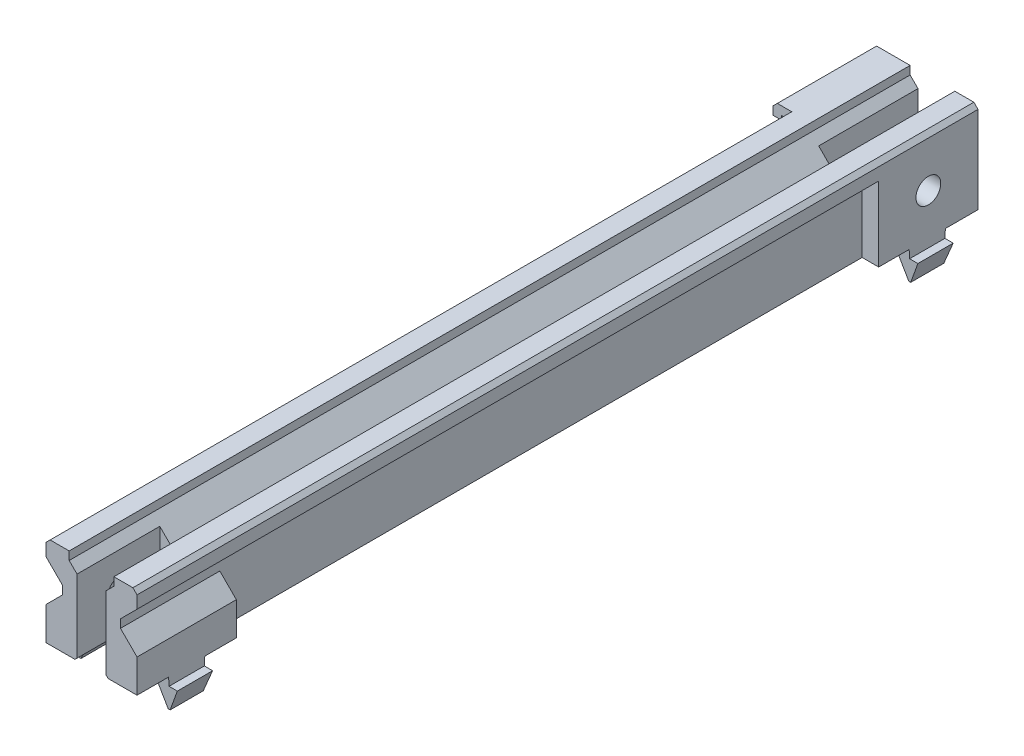
from build123d import *

# Parameters (mm, degrees)
SKETCH1_W                        = 5.5
SKETCH1_H                        = 11
MAIN_BASE_DEPTH                  = 101.61
SIDE_CUT_OUT_DEPTH               = 89.61
TOP_RUBBER_BAND_CUT_OUT_DEPTH    = 103.351561297
BOTTOM_RUBBER_BAND_CUT_OUT_DEPTH = 103.351561297
SKETCH6_W                        = 1.75
SKETCH6_H                        = 11
MOTOR_PULLEY_CUT_OUT_DEPTH       = 12
SKETCH7_W                        = 1.75
SKETCH7_H                        = 11
PULLEY_CUT_OUT_DEPTH             = 10
SKETCH11_R                       = 1.5
MOTOR_SHAFT_CUT_OUT_DEPTH        = 103.272452792
SNAP_START                       = 5.27
SNAP_HOOK_DRIVEN_SIDE_DEPTH      = 0.23
SNAP_START_2                     = -97.613689555
SNAP_HOOK_DRIVEN_SIDE_2_DEPTH    = 4.266231519
SNAP_START_3                     = -97.666097334
SNAP_HOOK_DRIVEN_SIDE_3_DEPTH    = 4.371047077
SNAP_START_4                     = 3
SNAP_HOOK_DRIVEN_SIDE_4_DEPTH    = 4
SKETCH16_W                       = 2
SKETCH16_H                       = 6
SNAP_HOOK_BASE_DEPTH             = 12
SNAP_HOOK_BASE_CHAMFER_SIZE      = 2
SNAP_HOOK_GUIDE_SIDE_DEPTH       = 0.23
SNAP_START_5                     = -8.132595504
SNAP_HOOK_GUIDE_SIDE_2_DEPTH     = 4.266231519
SNAP_START_6                     = -8.185003283
SNAP_HOOK_GUIDE_SIDE_3_DEPTH     = 4.371047078
SNAP_HOOK_GUIDE_SIDE_4_DEPTH     = 4
SKETCH13_W                       = 1
SKETCH13_H                       = 0.5
BOSS_EXTRUDE3_DEPTH              = 12
RAIL_CHAMFER_SIZE                = 0.5


with BuildPart() as part:
    # Sketch1 → main_base (new body)
    with BuildSketch(Plane.XY):
        with Locations((2.75, 5.5)):
            Rectangle(SKETCH1_W, SKETCH1_H)
    extrude(amount=-MAIN_BASE_DEPTH)

    # Sketch3 → side_cut_out (cut)
    with BuildSketch(Plane.XY):
        Polygon((5.5, 9), (3.5, 7), (3.5, 0), (5.5, 0), align=None)
    extrude(amount=-SIDE_CUT_OUT_DEPTH, mode=Mode.SUBTRACT)

    # Sketch4 → top_rubber_band_cut_out (cut, through all)
    with BuildSketch(Plane.XY):
        Polygon((0, 7.3), (0, 11), (2.7, 11), (2.7, 10), align=None)
    extrude(amount=-TOP_RUBBER_BAND_CUT_OUT_DEPTH, mode=Mode.SUBTRACT)

    # Sketch5 → bottom_rubber_band_cut_out (cut, through all)
    with BuildSketch(Plane.XY):
        Polygon((2, 0), (0, 2), (0, 0), align=None)
    extrude(amount=-BOTTOM_RUBBER_BAND_CUT_OUT_DEPTH, mode=Mode.SUBTRACT)

    # Sketch6 → motor_pulley_cut_out (cut)
    with BuildSketch(Plane(origin=(0, 0, -101.61), x_dir=(-1, 0, 0), z_dir=(0, 0, -1))):
        with Locations((-0.875, 5.5)):
            Rectangle(SKETCH6_W, SKETCH6_H)
    extrude(amount=-MOTOR_PULLEY_CUT_OUT_DEPTH, mode=Mode.SUBTRACT)

    # Sketch7 → pulley_cut_out (cut)
    with BuildSketch(Plane.XY):
        with Locations((0.875, 5.5)):
            Rectangle(SKETCH7_W, SKETCH7_H)
    extrude(amount=-PULLEY_CUT_OUT_DEPTH, mode=Mode.SUBTRACT)

    # Sketch10 → half_circle_cut_out (revolve, cut)
    with BuildSketch(Plane(origin=(0, 5, 0), x_dir=(1, 0, 0), z_dir=(0, 1, 0))):
        with BuildLine():
            Line((1.5, 5), (1.5, 3.75))
            ThreePointArc((1.5, 3.75), (2.383883476, 4.116116524), (2.75, 5))
            Line((2.75, 5), (1.5, 5))
        make_face()
    revolve(axis=Axis((2.75, 5, -5), (-1, 0, 0)), mode=Mode.SUBTRACT)

    # Sketch11 → motor_shaft_cut_out (cut, through all)
    with BuildSketch(Plane.ZY.offset(-1.75)):
        with Locations((-95.61, 5)):
            Circle(SKETCH11_R)
    extrude(amount=-MOTOR_SHAFT_CUT_OUT_DEPTH, mode=Mode.SUBTRACT)



with BuildPart() as body_2:
    # Snap Hook Driven Side: read off the stored shape, not the designer's step
    # Snap Hook Driven Side outline → Snap Hook Driven Side (new body)
    with BuildSketch(Plane.YZ.offset(SNAP_START)):
        Polygon((-1, -97.613689555), (-1, -93.347458036), (-3.54, -93.480573796), (-3.54, -97.480573796), align=None)
    extrude(amount=SNAP_HOOK_DRIVEN_SIDE_DEPTH)


with BuildPart() as part_1:
    add(part.part)

    add(body_2.part)  # Snap Hook Driven Side 2 merges body 2
    # Snap Hook Driven Side 2 outline → Snap Hook Driven Side 2 (add)
    with BuildSketch(Plane.XY.offset(SNAP_START_2)):
        Polygon((5.5, 0), (3.5, 0), (5.27, -3.54), (5.27, -1), (5.5, -1), align=None)
        Polygon((6.5, -1), (5.5, -1), (5.5, -3.54), align=None)
    extrude(amount=SNAP_HOOK_DRIVEN_SIDE_2_DEPTH)

    # Snap Hook Driven Side 3 outline → Snap Hook Driven Side 3 (add)
    with BuildSketch(Plane.XY.offset(SNAP_START_3)):
        Polygon((5.5, 0), (3.5, 0), (5.27, -3.54), (5.27, -1), (5.5, -1), align=None)
    extrude(amount=SNAP_HOOK_DRIVEN_SIDE_3_DEPTH)

    # Snap Hook Driven Side 4 outline → Snap Hook Driven Side 4 (cut)
    with BuildSketch(Plane.YZ.offset(SNAP_START_4)):
        Polygon((0, -93.295050257), (-5, -93.295050257), (-5, -93.557089154), (-3.54, -93.480573796), align=None)
        Polygon((-3.54, -97.480573796), (-5, -97.404058439), (-5, -97.666097334), (0, -97.666097334), align=None)
    extrude(amount=SNAP_HOOK_DRIVEN_SIDE_4_DEPTH, mode=Mode.SUBTRACT)

    # Sketch16 → Snap Hook Base (add)
    with BuildSketch(Plane.XY):
        with Locations((4.5, 3)):
            Rectangle(SKETCH16_W, SKETCH16_H)
    extrude(amount=-SNAP_HOOK_BASE_DEPTH)

    # Snap Hook Base Chamfer
    snap_hook_base_chamfer_edges = [part_1.edges().sort_by_distance(p)[0] for p in [
        (5.5, 6, -6),
    ]]
    chamfer(snap_hook_base_chamfer_edges, length=SNAP_HOOK_BASE_CHAMFER_SIZE - 0.0001)  # a hair under: the kernel refuses the full size



with BuildPart() as body_2_2:
    # Snap Hook Guide Side: read off the stored shape, not the designer's step
    # Snap Hook Guide Side outline → Snap Hook Guide Side (new body)
    with BuildSketch(Plane.YZ.offset(SNAP_START)):
        Polygon((-1, -3.866363984), (-3.54, -3.999479744), (-3.54, -7.999479744), (-1, -8.132595504), align=None)
    extrude(amount=SNAP_HOOK_GUIDE_SIDE_DEPTH)


with BuildPart() as part_2:
    add(part_1.part)

    add(body_2_2.part)  # Snap Hook Guide Side 2 merges body 2 2
    # Snap Hook Guide Side 2 outline → Snap Hook Guide Side 2 (add)
    with BuildSketch(Plane.XY.offset(SNAP_START_5)):
        Polygon((5.27, -1), (5.5, -1), (5.5, 0), (3.5, 0), (5.27, -3.54), align=None)
        Polygon((6.5, -1), (5.5, -1), (5.5, -3.54), align=None)
    extrude(amount=SNAP_HOOK_GUIDE_SIDE_2_DEPTH)

    # Snap Hook Guide Side 3 outline → Snap Hook Guide Side 3 (add)
    with BuildSketch(Plane.XY.offset(SNAP_START_6)):
        Polygon((5.27, -1), (5.5, -1), (5.5, 0), (3.5, 0), (5.27, -3.54), align=None)
    extrude(amount=SNAP_HOOK_GUIDE_SIDE_3_DEPTH)

    # Snap Hook Guide Side 4 outline → Snap Hook Guide Side 4 (cut)
    with BuildSketch(Plane.YZ.offset(SNAP_START_4)):
        Polygon((0, -3.813956205), (-5, -3.813956205), (-5, -4.075995102), (-3.54, -3.999479744), align=None)
        Polygon((-3.54, -7.999479744), (-5, -7.922964386), (-5, -8.185003283), (0, -8.185003283), align=None)
    extrude(amount=SNAP_HOOK_GUIDE_SIDE_4_DEPTH, mode=Mode.SUBTRACT)

    # final_mirror: part across plane


with BuildPart() as part_3:
    add(part_2.part)
    add(part_2.part.mirror(Plane(origin=(0, 0, 0), x_dir=(0, 0, 1), z_dir=(1, 0, 0))))

    # Sketch13 → Boss-Extrude3 (add)
    with BuildSketch(Plane(origin=(0, 0, -101.61), x_dir=(-1, 0, 0), z_dir=(0, 0, -1))):
        Polygon((7.25, 11), (5.5, 11), (5.5, 10), (6.25, 10), (7.25, 10), align=None)
        with Locations((6.75, 9.75)):
            Rectangle(SKETCH13_W, SKETCH13_H)
    extrude(amount=-BOSS_EXTRUDE3_DEPTH)

    # rail_chamfer
    rail_chamfer_edges = [part_3.edges().sort_by_distance(p)[0] for p in [
        (-5.5, 11, -44.805),
        (-7.25, 11, -95.61),
        (5.5, 11, -50.805),
    ]]
    chamfer(rail_chamfer_edges, length=RAIL_CHAMFER_SIZE)


solid = part_3.part
